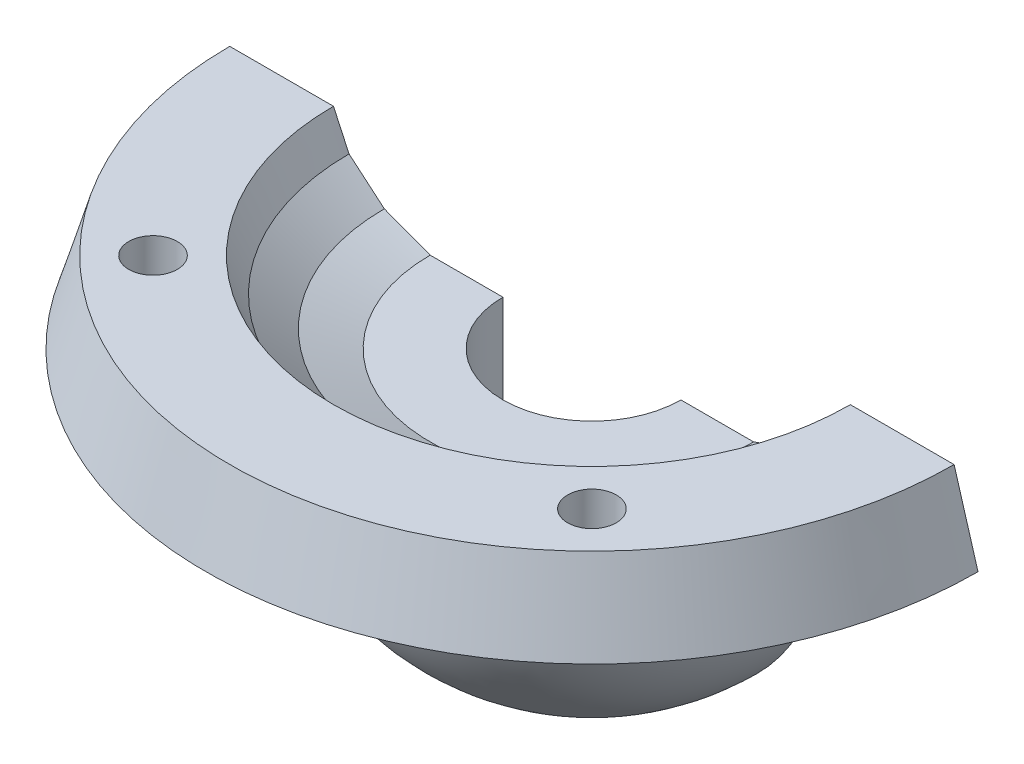
from build123d import *

# Parameters (mm, degrees)
REVOLVE1_ANGLE     = 180
FILLET1_SIZE       = 4
FILLET1_SIZE_2     = 2
CHAMFER1_SIZE      = 4
CHAMFER1_SIZE2     = 0.705307923
REVOLVE2_ANGLE     = 180
SKETCH3_R          = 1.5
CUT_EXTRUDE1_DEPTH = 10


with BuildPart() as part:
    # Sketch1 → Revolve1 (revolve)
    with BuildSketch(Plane.XY):
        Polygon((0, -9.5), (0, 2), (-5.5, 2), (-5.5, -3.5), (-10, -3.5), (-10, -9.5), align=None)
    revolve(axis=Axis((0, -14.5, 0), (0, 1, 0)), revolution_arc=REVOLVE1_ANGLE)

    # Fillet1
    # an asymmetric fillet: 4, 2 mm, written as the material it takes off along each edge
    with BuildSketch(Plane(origin=(0, -9.5, 0), x_dir=(-0.5389483633149525, 0, -0.8423388045674578), z_dir=(0.8423388045674578, 0, -0.5389483633149525))) as fillet1_piece_1:
        with BuildLine():
            Bezier((10 - FILLET1_SIZE, 0), (10, 0), (10, FILLET1_SIZE_2), weights=[1, 0.707106781, 1])
            Line((10, FILLET1_SIZE_2), (10, 0))
            Line((10, 0), (10 - FILLET1_SIZE, 0))
        make_face()
    revolve(axis=Axis((0, -9.5, 0), (0, 1, 0)), revolution_arc=294.775843921, mode=Mode.SUBTRACT)

    # Chamfer1
    chamfer1_edges = [part.edges().sort_by_distance(p)[0] for p in [
        (0, -3.5, 10),
    ]]
    chamfer1_side = [part.faces().sort_by_distance(p)[0] for p in [
        (0, -3.5, 5.723606798),
    ]]
    chamfer(chamfer1_edges, length=CHAMFER1_SIZE, length2=CHAMFER1_SIZE2, reference=chamfer1_side[0])


with BuildPart() as body_2:
    # Sketch2 → Revolve2 (revolve)
    with BuildSketch(Plane.XY):
        with BuildLine():
            Line((-5.5, 2), (-10, 2))
            Line((-10, 2), (-12.831859955, 3.064721462))
            Line((-12.831859955, 3.064721462), (-15.01308486, 4.913217144))
            Line((-15.01308486, 4.913217144), (-15.974302614, 6.983532307))
            Line((-15.974302614, 6.983532307), (-19.387891627, 6.983532307))
            Line((-19.387891627, 6.983532307), (-22.387891627, 6.983532307))
            Line((-22.387891627, 6.983532307), (-23.863690319, 1.983532307))
            Line((-23.863690319, 1.983532307), (-14.363690319, 1.983532307))
            ThreePointArc((-14.363690319, 1.983532307), (-10.931862112, -9.525985029), (0, -14.5))
            Line((0, -14.5), (0, -9.5))
            Line((0, -9.5), (-5.99955163, -9.5))
            add(Edge.make_bspline(
                [(-5.99955163, -9.5), (-6.613966051, -9.500022958), (-7.200553434, -9.407759327), (-7.834490948, -9.308048049), (-8.370669156, -9.110794638), (-9.014660015, -8.873878269), (-9.427521538, -8.530743599), (-9.68430445, -8.317327925), (-9.82887241, -8.078117533), (-9.999615313, -7.795596589), (-9.999626359, -7.5)],
                knots=[0, 0, 0, 0.25, 0.25, 0.5, 0.5, 0.75, 0.75, 0.875, 0.875, 1, 1, 1], degree=2))
            Line((-9.999626359, -7.5), (-10, -4.205307923))
            Line((-10, -4.205307923), (-6.14232061, -3.5))
            Line((-6.14232061, -3.5), (-5.5, -3.5))
            Line((-5.5, -3.5), (-5.5, 2))
        make_face()
    revolve(axis=Axis((0, -9.5, 0), (0, 1, 0)), revolution_arc=REVOLVE2_ANGLE)

    # Sketch3 → Cut-Extrude1 (cut)
    with BuildSketch(Plane(origin=(0, 6.983532307, 0), x_dir=(1, 0, 0), z_dir=(0, 1, 0))):
        with Locations(Location((13.564701596, -13.564701596, 0), (0, 0, 270))):
            Circle(SKETCH3_R)
    cut_extrude1 = extrude(amount=-CUT_EXTRUDE1_DEPTH, mode=Mode.SUBTRACT)

    # Mirror1: Cut-Extrude1 across plane
    add(cut_extrude1.mirror(Plane(origin=(0, 0, 0), x_dir=(0, 0, 1), z_dir=(1, 0, 0))), mode=Mode.SUBTRACT)


solid = body_2.part
